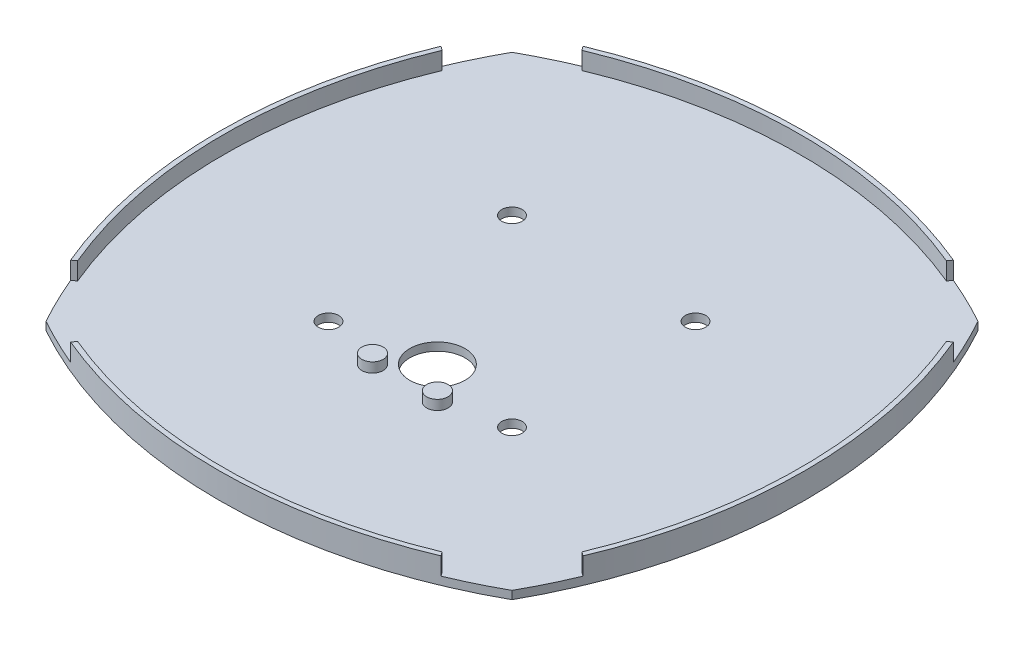
from build123d import *

# Parameters (mm, degrees)
BOSS_EXTRUDE1_DEPTH     = 2.5
BOSS_EXTRUDE2_DEPTH     = 5.4
CUT_EXTRUDE2_DEPTH      = 324.312541101
CUT_EXTRUDE2_DEPTH_BACK = 324.312541101
SKETCH11_R              = 3.15
SKETCH11_R_2            = 8.5
SKETCH13_R              = 3.289472506
BOSS_EXTRUDE3_DEPTH     = 3


with BuildPart() as part:
    # Sketch3 → Boss-Extrude1 (new body)
    with BuildSketch(Plane(origin=(0, 0, 0), x_dir=(1, 0, 0), z_dir=(0, 1, 0))):
        with BuildLine():
            ThreePointArc((271.153533245, 18.921159404), (199.331937646, 37.525228411), (127.510342047, 18.921159404))
            ThreePointArc((127.510342047, 18.921159404), (108.90627304, -52.900436194), (127.510342047, -124.722031793))
            ThreePointArc((127.510342047, -124.722031793), (199.331937646, -143.3261008), (271.153533245, -124.722031793))
            ThreePointArc((271.153533245, -124.722031793), (289.757602252, -52.900436194), (271.153533245, 18.921159404))
        make_face()
    extrude(amount=BOSS_EXTRUDE1_DEPTH)

    # Sketch5 → Boss-Extrude2 (add)
    with BuildSketch(Plane(origin=(0, 2.5, 0), x_dir=(1, 0, 0), z_dir=(0, 1, 0))):
        with BuildLine():
            Line((121.611565862, -109.080289564), (120.36423024, -109.98653194))
            ThreePointArc((120.36423024, -109.98653194), (108.906273045, -52.899217103), (120.365171108, 4.187908885))
            Line((120.365171108, 4.187908885), (121.612501818, 3.281670078))
            ThreePointArc((121.612501818, 3.281670078), (110.406273045, -52.899216401), (121.611565862, -109.080289564))
        make_face()
        with BuildLine():
            Line((143.152084277, -130.620807978), (142.2458419, -131.8681436))
            ThreePointArc((142.2458419, -131.8681436), (199.331937646, -143.3261008), (256.418033392, -131.8681436))
            Line((256.418033392, -131.8681436), (255.511791015, -130.620807978))
            ThreePointArc((255.511791015, -130.620807978), (199.331937646, -141.8261008), (143.152084277, -130.620807978))
        make_face()
        with BuildLine():
            Line((277.052309429, 3.279417175), (278.299645052, 4.185659552))
            ThreePointArc((278.299645052, 4.185659552), (289.757602252, -52.900436194), (278.299645052, -109.98653194))
            Line((278.299645052, -109.98653194), (277.052309429, -109.080289564))
            ThreePointArc((277.052309429, -109.080289564), (288.257602252, -52.900436194), (277.052309429, 3.279417175))
        make_face()
        with BuildLine():
            Line((255.511791015, 24.819935589), (256.418033392, 26.067271212))
            ThreePointArc((256.418033392, 26.067271212), (199.330718555, 37.525228406), (142.243592567, 26.066330343))
            Line((142.243592567, 26.066330343), (143.149831374, 24.818999633))
            ThreePointArc((143.149831374, 24.818999633), (199.330717853, 36.025228406), (255.511791015, 24.819935589))
        make_face()
    extrude(amount=BOSS_EXTRUDE2_DEPTH)

    # Sketch11 → Cut-Extrude2 (cut, two sides: drawn at the far end of the back side and taken through both)
    with BuildSketch(Plane(origin=(0, 2.5, 0), x_dir=(1, 0, 0), z_dir=(0, 1, 0)).offset(-CUT_EXTRUDE2_DEPTH_BACK)):
        with Locations((171.047666398, -24.616164947)):
            Circle(SKETCH11_R)
        with Locations((227.616208893, -24.616164947)):
            Circle(SKETCH11_R)
        with Locations((227.616208893, -81.184707442)):
            Circle(SKETCH11_R)
        with Locations((171.047666398, -81.184707442)):
            Circle(SKETCH11_R)
        with Locations((199.331937646, -75.900436194)):
            Circle(SKETCH11_R_2)
    extrude(amount=CUT_EXTRUDE2_DEPTH + CUT_EXTRUDE2_DEPTH_BACK, mode=Mode.SUBTRACT)

    # Sketch13 → Boss-Extrude3 (add)
    with BuildSketch(Plane(origin=(0, 2.5, 0), x_dir=(1, 0, 0), z_dir=(0, 1, 0))):
        with Locations((189.331937646, -85.900436194)):
            Circle(SKETCH13_R)
        with Locations((209.331937646, -85.900436194)):
            Circle(SKETCH13_R)
    extrude(amount=BOSS_EXTRUDE3_DEPTH)


solid = part.part
